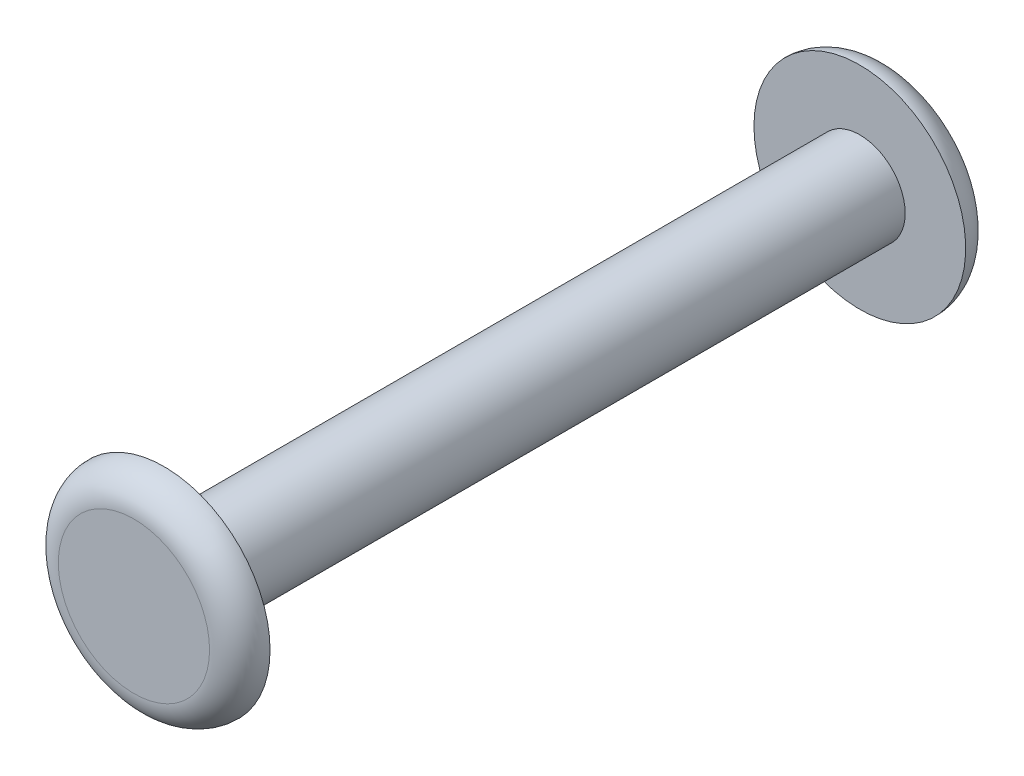
from build123d import *

# Parameters (mm, degrees)
SKETCH1_R           = 3.75
BOSS_EXTRUDE1_DEPTH = 28.75
BOSS_EXTRUDE2_START = 2.5
SKETCH2_R           = 8.75
SKETCH2_R_2         = 3.75
BOSS_EXTRUDE2_DEPTH = 2.5
SKETCH3_R           = 8.75
BOSS_EXTRUDE3_DEPTH = 2.5
FILLET1_R           = 2.5


with BuildPart() as part:
    # Sketch1 → Boss-Extrude1 (new, symmetric)
    with BuildSketch(Plane.XY):
        Circle(SKETCH1_R)
    extrude(amount=BOSS_EXTRUDE1_DEPTH, both=True)

    # Sketch2 → Boss-Extrude2 (add)
    # profile 1 of 2: a face of its own
    with BuildSketch(Plane.XY.offset(28.75).offset(BOSS_EXTRUDE2_START)):
        Circle(SKETCH2_R)
        Circle(SKETCH2_R_2, mode=Mode.SUBTRACT)
    # profile 2 of 2: a face of its own
    with BuildSketch(Plane.XY.offset(28.75).offset(BOSS_EXTRUDE2_START)):
        Circle(SKETCH2_R_2)
    extrude(amount=-BOSS_EXTRUDE2_DEPTH)

    # Sketch3 → Boss-Extrude3 (add)
    with BuildSketch(Plane(origin=(0, 0, -28.75), x_dir=(-1, 0, 0), z_dir=(0, 0, -1))):
        with Locations(Location((0, 0, 0), (0, 0, 180))):
            Circle(SKETCH3_R)
    extrude(amount=BOSS_EXTRUDE3_DEPTH)

    # Fillet1
    fillet1_edges = [part.edges().sort_by_distance(p)[0] for p in [
        (-8.75, 0, -31.25),
        (-8.75, 0, 31.25),
    ]]
    fillet(fillet1_edges, radius=FILLET1_R - 0.0001)  # a hair under: the kernel refuses the full size


solid = part.part
